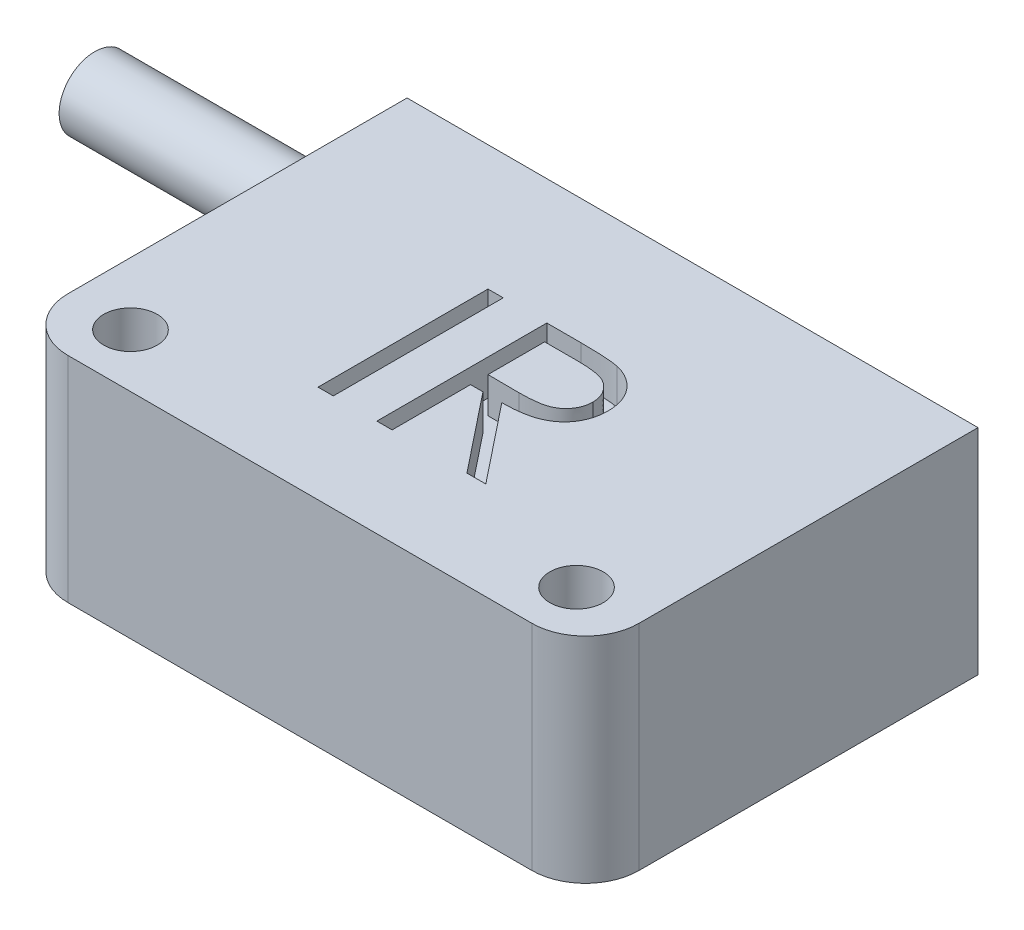
from build123d import *

# Parameters (mm, degrees)
SKETCH1_W           = 32
SKETCH1_H           = 22
BOSS_EXTRUDE1_DEPTH = 12
SKETCH2_R           = 2
BOSS_EXTRUDE2_DEPTH = 15
SKETCH3_R           = 1.5
CUT_EXTRUDE1_DEPTH  = 41.644802866
SKETCH4_W           = 0.854807692
SKETCH4_H           = 9.525
CUT_EXTRUDE2_DEPTH  = 2
FILLET1_R           = 3


with BuildPart() as part:
    # Sketch1 → Boss-Extrude1 (new body)
    with BuildSketch(Plane(origin=(0, 0, 0), x_dir=(1, 0, 0), z_dir=(0, 1, 0))):
        with Locations((16, 11)):
            Rectangle(SKETCH1_W, SKETCH1_H)
    extrude(amount=BOSS_EXTRUDE1_DEPTH)

    # Sketch2 → Boss-Extrude2 (add)
    with BuildSketch(Plane.ZY):
        with Locations((-19.5, 6)):
            Circle(SKETCH2_R)
    extrude(amount=BOSS_EXTRUDE2_DEPTH)

    # Sketch3 → Cut-Extrude1 (cut, through all)
    with BuildSketch(Plane(origin=(0, 12, 0), x_dir=(1, 0, 0), z_dir=(0, 1, 0))):
        with Locations((3.5, 3)):
            Circle(SKETCH3_R)
        with Locations((28.5, 3)):
            Circle(SKETCH3_R)
    extrude(amount=-CUT_EXTRUDE1_DEPTH, mode=Mode.SUBTRACT)

    # Sketch4 → Cut-Extrude2 (cut)
    # profile 1 of 2: a face of its own
    with BuildSketch(Plane(origin=(0, 12, 0), x_dir=(1, 0, 0), z_dir=(0, 1, 0))):
        with Locations((11.970192308, 10.231461459)):
            Rectangle(SKETCH4_W, SKETCH4_H)
    # profile 2 of 2: a face of its own
    with BuildSketch(Plane(origin=(0, 12, 0), x_dir=(1, 0, 0), z_dir=(0, 1, 0))):
        with BuildLine():
            Line((14.839903846, 14.993961459), (16.746048678, 14.993961459))
            add(Edge.make_bspline(
                [(16.746048678, 14.993961459), (16.87325132, 14.993538043), (17.117494485, 14.992725037), (17.467397456, 14.988191782), (17.785334056, 14.975198714), (18.071138047, 14.964017498), (18.324804187, 14.943628715), (18.547110314, 14.924141525), (18.737032548, 14.898631777), (18.852001615, 14.87494059), (18.90405649, 14.864213863)],
                knots=[0, 0, 0, 0, 1.410062039, 2.707475311, 3.878576406, 4.937260626, 5.877586885, 6.699081471, 7.410979367, 8, 8, 8, 8], degree=3))
            add(Edge.make_bspline(
                [(18.90405649, 14.864213863), (18.973743089, 14.846996023), (19.111629682, 14.812927646), (19.310158076, 14.740919733), (19.499336343, 14.657590611), (19.678378651, 14.559717915), (19.846388197, 14.446575122), (20.005097314, 14.320115446), (20.155226182, 14.181030836), (20.290703333, 14.025814589), (20.418444609, 13.862973802), (20.526182228, 13.686887149), (20.619055005, 13.502751135), (20.692997627, 13.308693091), (20.752536969, 13.106594983), (20.794518377, 12.894626186), (20.819694824, 12.67375239), (20.822258016, 12.523099795), (20.823557692, 12.446710858)],
                knots=[0, 0, 0, 0, 1.027469482, 2.033020251, 3.019912614, 3.986113645, 4.951240523, 5.91722682, 6.890402269, 7.87763091, 8.8651537, 9.85103654, 10.82876324, 11.815024772, 12.821070561, 13.842952187, 14.906261191, 16, 16, 16, 16], degree=3))
            add(Edge.make_bspline(
                [(20.823557692, 12.446710858), (20.819559919, 12.319796752), (20.811759227, 12.07215446), (20.739028767, 11.712760204), (20.619894095, 11.377509283), (20.455728573, 11.066823819), (20.246669857, 10.786759848), (19.995414533, 10.54076868), (19.701822433, 10.334920061), (19.428511223, 10.1921735), (19.187081865, 10.100752798), (18.988326921, 10.036428136), (18.771518932, 9.986729502), (18.538735186, 9.942206572), (18.289006952, 9.908592318), (18.022932774, 9.883972657), (17.740322889, 9.868585568), (17.546178708, 9.866294111), (17.446304087, 9.865115305)],
                knots=[0, 0, 0, 0, 1.260483769, 2.459530307, 3.627416485, 4.787058657, 5.939039949, 7.08810263, 8.267026773, 9.491475466, 10.141966685, 10.831826277, 11.566392101, 12.351337768, 13.187381173, 14.07005841, 15.007169909, 16, 16, 16, 16], degree=3))
            Line((17.446304087, 9.865115305), (20.945673077, 5.468961459))
            Line((20.945673077, 5.468961459), (19.888611779, 5.468961459))
            Line((19.888611779, 5.468961459), (16.389242788, 9.865115305))
            Line((16.389242788, 9.865115305), (15.694711538, 9.865115305))
            Line((15.694711538, 9.865115305), (15.694711538, 5.468961459))
            Line((15.694711538, 5.468961459), (14.839903846, 5.468961459))
            Line((14.839903846, 5.468961459), (14.839903846, 14.993961459))
        make_face()
        with BuildLine():
            Line((15.694711538, 14.017038382), (15.694711538, 10.842038382))
            Line((15.694711538, 10.842038382), (17.438671875, 10.828682012))
            add(Edge.make_bspline(
                [(17.438671875, 10.828682012), (17.520097124, 10.82864599), (17.677922447, 10.828576167), (17.906252113, 10.839444944), (18.118850417, 10.85180926), (18.314904179, 10.870721408), (18.49450098, 10.895094717), (18.657551055, 10.925582839), (18.80432056, 10.961103095), (18.97549444, 11.016080377), (19.166638143, 11.103182469), (19.374368759, 11.229907148), (19.551267978, 11.389298822), (19.700723017, 11.571562299), (19.820818113, 11.77195809), (19.905487347, 11.988084066), (19.959214993, 12.214484058), (19.965551963, 12.370090195), (19.96875, 12.448618911)],
                knots=[0, 0, 0, 0, 1.146690395, 2.22261258, 3.21895312, 4.145990853, 4.996080663, 5.770904154, 6.481378293, 7.121626537, 8.300444488, 9.431385265, 10.535395872, 11.636531494, 12.74115979, 13.810798291, 14.895190096, 16, 16, 16, 16], degree=3))
            add(Edge.make_bspline(
                [(19.96875, 12.448618911), (19.965478513, 12.525217801), (19.95899562, 12.677008851), (19.906067186, 12.899229578), (19.816561084, 13.108961778), (19.695941279, 13.305352269), (19.548986436, 13.48362145), (19.376671532, 13.636149774), (19.183708108, 13.762014389), (19.003355775, 13.842444524), (18.842154097, 13.891756411), (18.702191951, 13.926457792), (18.544045715, 13.954337382), (18.366947502, 13.976675034), (18.17165335, 13.995874561), (17.957175792, 14.008806187), (17.72493784, 14.016463917), (17.563973692, 14.016842438), (17.480649038, 14.017038382)],
                knots=[0, 0, 0, 0, 1.101028733, 2.181837193, 3.264309656, 4.369019818, 5.486613113, 6.575447106, 7.666700264, 8.788928104, 9.402425223, 10.0903467, 10.862060571, 11.710948788, 12.657782767, 13.684531032, 14.801375019, 16, 16, 16, 16], degree=3))
            Line((17.480649038, 14.017038382), (15.694711538, 14.017038382))
        make_face(mode=Mode.SUBTRACT)
    extrude(amount=-CUT_EXTRUDE2_DEPTH, mode=Mode.SUBTRACT)


with BuildPart() as body_2:
    # Split1: the piece on the far side of the plane
    add(part.part)
    split(bisect_by=Plane(origin=(0, 12, 0), x_dir=(0, 0, 1), z_dir=(1, 0, 0)), keep=Keep.BOTTOM)


with BuildPart() as part_1:
    add(part.part)

    # Split1
    split(bisect_by=Plane(origin=(0, 12, 0), x_dir=(0, 0, 1), z_dir=(1, 0, 0)), keep=Keep.TOP)

    # Fillet1
    fillet1_edges = [part_1.edges().sort_by_distance(p)[0] for p in [
        (32, 6, 0),
        (0, 6, 0),
    ]]
    fillet(fillet1_edges, radius=FILLET1_R)


solid = Compound([body_2.part, part_1.part])
